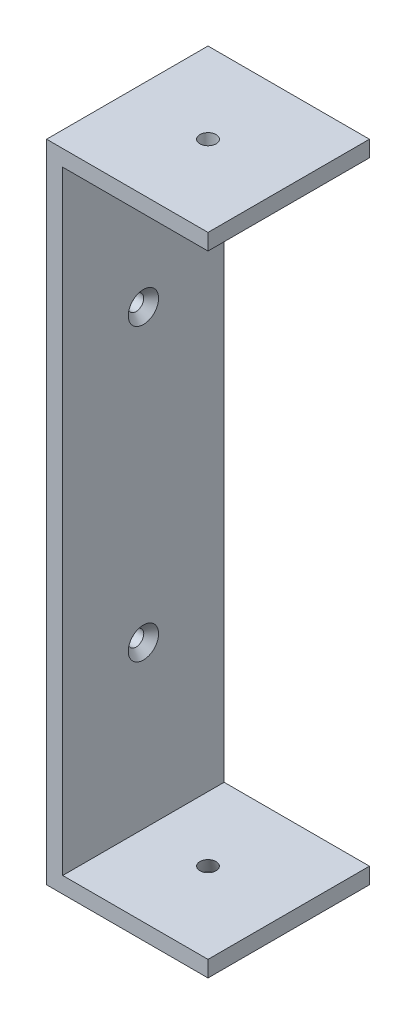
from build123d import *

# Parameters (mm, degrees)
SKETCH1_W                                           = 50
SKETCH1_H                                           = 50
BOSS_EXTRUDE1_DEPTH                                 = 200
SKETCH2_W                                           = 45
SKETCH2_H                                           = 190
CUT_EXTRUDE1_DEPTH                                  = 50
HOLE1_START                                         = 195
HOLE1_OUTLINE_R                                     = 2.5
HOLE1_DEPTH                                         = 5
SKETCH12_R                                          = 2.5
CUT_EXTRUDE2_DEPTH                                  = 5
CUT_EXTRUDE2_DRAFT                                  = 25
CSK_FOR_M4_COUNTERSUNK_FLAT_HEAD_SCREW1_D           = 4.8
CSK_FOR_M4_COUNTERSUNK_FLAT_HEAD_SCREW1_CSINK_D     = 9.4
CSK_FOR_M4_COUNTERSUNK_FLAT_HEAD_SCREW1_CSINK_ANGLE = 90


# Read off the part's stored shape, not the designer's step: Hole1
with BuildPart() as part:
    # Sketch1 → Boss-Extrude1 (new body)
    with BuildSketch(Plane(origin=(0, 0, 0), x_dir=(1, 0, 0), z_dir=(0, 1, 0))):
        with Locations((25, 25)):
            Rectangle(SKETCH1_W, SKETCH1_H)
    extrude(amount=BOSS_EXTRUDE1_DEPTH)

    # Sketch2 → Cut-Extrude1 (cut)
    with BuildSketch(Plane.XY):
        with Locations((27.5, 100)):
            Rectangle(SKETCH2_W, SKETCH2_H)
    extrude(amount=-CUT_EXTRUDE1_DEPTH, mode=Mode.SUBTRACT)

    # Hole1 outline → Hole1 (cut)
    with BuildSketch(Plane(origin=(0, 0, 0), x_dir=(1, 0, 0), z_dir=(0, 1, 0)).offset(HOLE1_START)):
        with Locations((25, 25)):
            Circle(HOLE1_OUTLINE_R)
    extrude(amount=HOLE1_DEPTH, mode=Mode.SUBTRACT)


with BuildPart() as cut_extrude2_tool:
    # Sketch12 → Cut-Extrude2 (with draft: the straight prism first)
    with BuildSketch(Plane(origin=(0, 5, 0), x_dir=(1, 0, 0), z_dir=(0, 1, 0))):
        with Locations(Location((25, 25, 0), (0, 0, 270))):
            Circle(SKETCH12_R)
    extrude(amount=-CUT_EXTRUDE2_DEPTH)
    # Cut-Extrude2: the draft: its side faces are tilted about the plane it starts from
    cut_extrude2_sides = [cut_extrude2_tool.faces().sort_by_distance(p)[0] for p in [
        (25, 2.5, -27.5),
    ]]
    draft(cut_extrude2_sides, Plane(origin=(0, 5, 0), x_dir=(1, 0, 0), z_dir=(0, 1, 0)), CUT_EXTRUDE2_DRAFT)


with BuildPart() as part_1:
    add(part.part)

    # Cut-Extrude2: cut by cut_extrude2_tool
    add(cut_extrude2_tool.part, mode=Mode.SUBTRACT)

    # CSK for M4 Countersunk Flat Head Screw1 (through all)
    with Locations(Plane(origin=(5, 0, 0), x_dir=(0, 0, -1), z_dir=(1, 0, 0))):
        with Locations((25, 145), (25, 55)):
            CounterSinkHole(CSK_FOR_M4_COUNTERSUNK_FLAT_HEAD_SCREW1_D / 2, CSK_FOR_M4_COUNTERSUNK_FLAT_HEAD_SCREW1_CSINK_D / 2, counter_sink_angle=CSK_FOR_M4_COUNTERSUNK_FLAT_HEAD_SCREW1_CSINK_ANGLE)


solid = part_1.part
